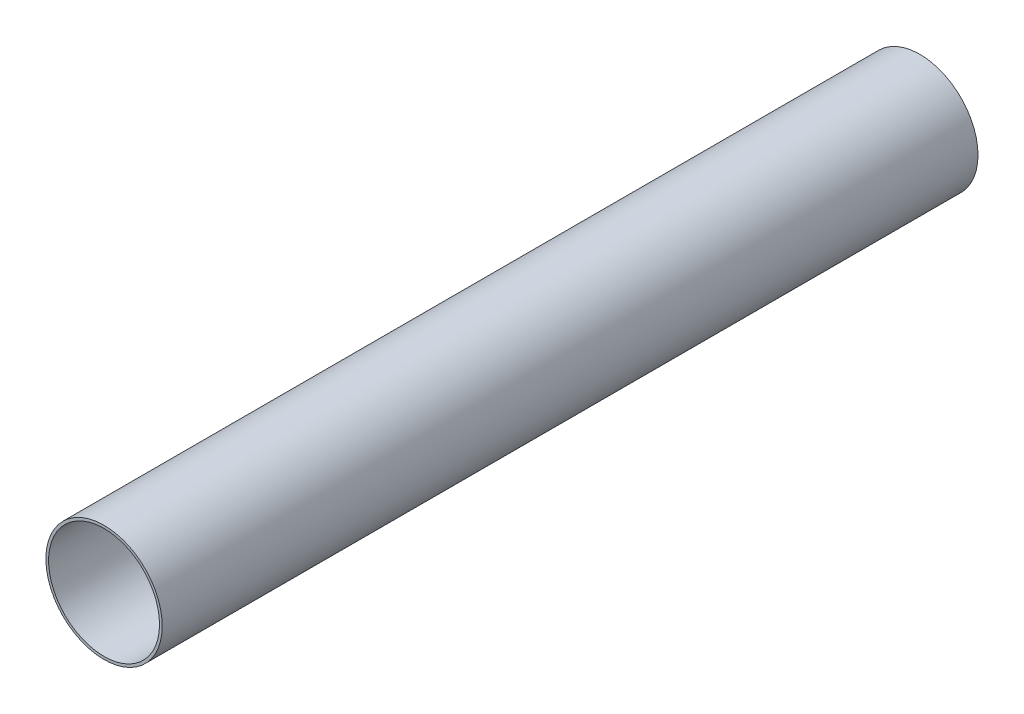
from build123d import *

# Parameters (mm, degrees)
BOSS_EXTRUDE1_DEPTH      = 362
BOSS_EXTRUDE1_DEPTH_BACK = 362
SKETCH2_R                = 51.6125
SKETCH2_R_2              = 49.2125


with BuildPart() as part:
    # Sketch2 → Boss-Extrude1 (new, two sides: drawn at the far end of the back side and taken through both)
    with BuildSketch(Plane.XY.offset(-BOSS_EXTRUDE1_DEPTH_BACK)):
        Circle(SKETCH2_R)
        Circle(SKETCH2_R_2, mode=Mode.SUBTRACT)
    extrude(amount=BOSS_EXTRUDE1_DEPTH + BOSS_EXTRUDE1_DEPTH_BACK)


solid = part.part
